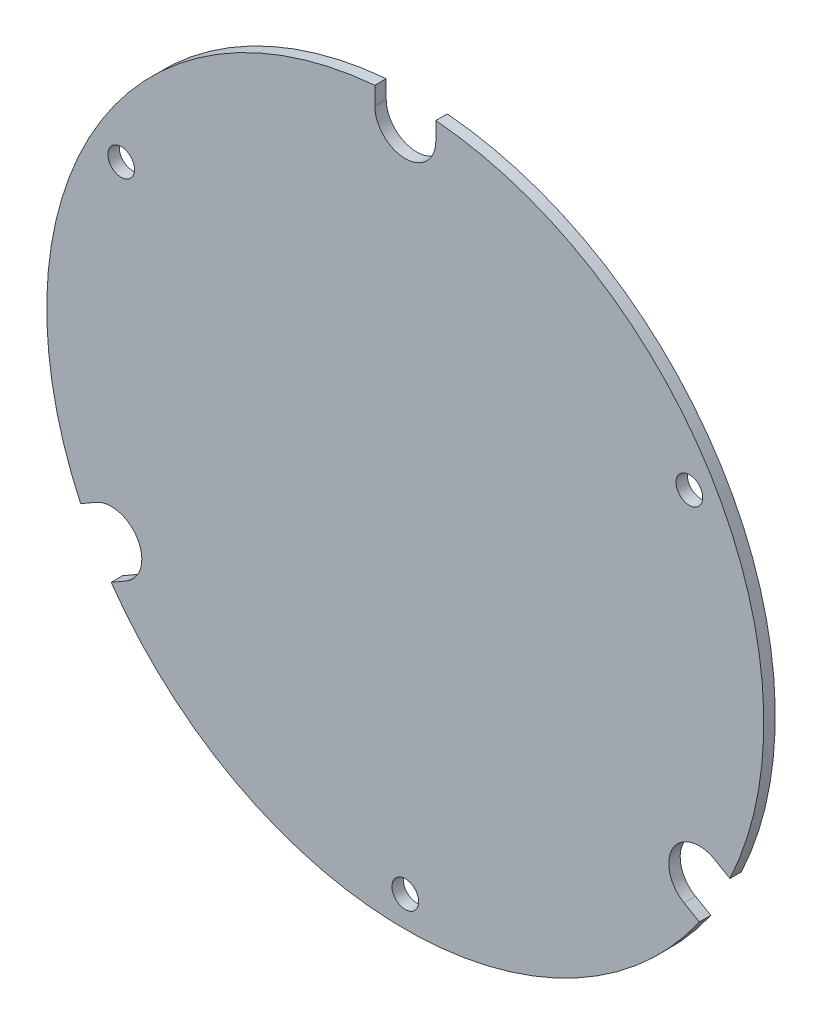
from build123d import *

# Parameters (mm, degrees)
SALIENTE_EXTRUIR1_DEPTH = 1.5
CROQUIS2_R              = 1.75
CORTAR_EXTRUIR1_DEPTH   = 1.5


with BuildPart() as part:
    # Croquis1 → Saliente-Extruir1 (new body)
    with BuildSketch(Plane.XY):
        with BuildLine():
            ThreePointArc((1, 40.627016654), (-2.449489743, 41.33772234), (-4, 44.5))
            Line((-4, 44.5), (-4, 46.829477896))
            ThreePointArc((-4, 46.829477896), (-40.703193978, 23.5), (-42.555517504, -19.950637333))
            Line((-42.555517504, -19.950637333), (-40.538130468, -18.785898385))
            ThreePointArc((-40.538130468, -18.785898385), (-35.074028853, -20.25), (-36.538130468, -25.714101615))
            Line((-36.538130468, -25.714101615), (-38.555517504, -26.878840563))
            ThreePointArc((-38.555517504, -26.878840563), (0, -47), (38.555517504, -26.878840563))
            Line((38.555517504, -26.878840563), (36.538130468, -25.714101615))
            ThreePointArc((36.538130468, -25.714101615), (35.074028853, -20.25), (40.538130468, -18.785898385))
            Line((40.538130468, -18.785898385), (42.555517504, -19.950637333))
            ThreePointArc((42.555517504, -19.950637333), (40.703193978, 23.5), (4, 46.829477896))
            Line((4, 46.829477896), (4, 44.5))
            ThreePointArc((4, 44.5), (3.16227766, 42.050510257), (1, 40.627016654))
        make_face()
    extrude(amount=SALIENTE_EXTRUIR1_DEPTH)

    # Croquis2 → Cortar-Extruir1 (cut)
    with BuildSketch(Plane.XY.offset(1.5)):
        with Locations((-37.239092363, 21.5)):
            Circle(CROQUIS2_R)
        with Locations((37.239092363, 21.5)):
            Circle(CROQUIS2_R)
        with Locations((0, -43)):
            Circle(CROQUIS2_R)
    extrude(amount=-CORTAR_EXTRUIR1_DEPTH, mode=Mode.SUBTRACT)


solid = part.part
